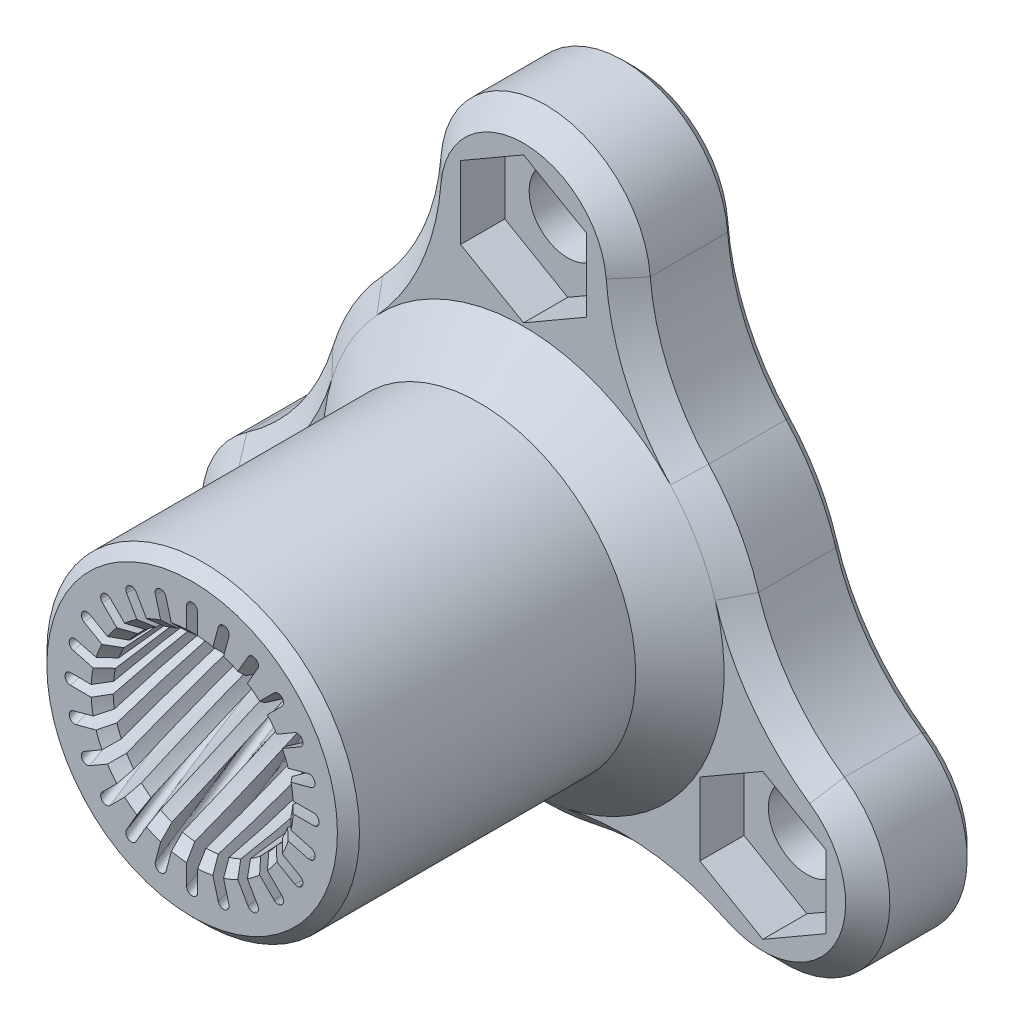
from build123d import *

# Parameters (mm, degrees)
SKETCH1_R              = 7.075
SKETCH1_R_2            = 4.075
BOSS_EXTRUDE1_DEPTH    = 20
CHAMFER3_SIZE          = 0.5
CUT_SWEEP1_PITCH       = 100
CUT_SWEEP1_HEIGHT      = 20
CUT_SWEEP1_RADIUS      = 4
CUT_SWEEP1_START_ANGLE = 180
CIRPATTERN1_COUNT      = 24
SKETCH5_R              = 1.75
SKETCH5_R_2            = 7.075
BOSS_EXTRUDE2_DEPTH    = 3
SKETCH6_R              = 7.075
BOSS_EXTRUDE3_DEPTH    = 2
CHAMFER1_SIZE          = 2
CHAMFER2_SIZE          = 1
CHAMFER4_SIZE          = 0.5


with BuildPart() as part:
    # Sketch1 → Boss-Extrude1 (new body)
    with BuildSketch(Plane.XY):
        Circle(SKETCH1_R)
        Circle(SKETCH1_R_2, mode=Mode.SUBTRACT)
    extrude(amount=BOSS_EXTRUDE1_DEPTH)

    # Chamfer3
    chamfer3_edges = [part.edges().sort_by_distance(p)[0] for p in [
        (-4.075, 0, 0),
        (-4.075, 0, 20),
    ]]
    chamfer(chamfer3_edges, length=CHAMFER3_SIZE)

    # Cut-Sweep1: sweep along a helix
    with BuildLine() as cut_sweep1_path:
        add(Helix(CUT_SWEEP1_PITCH, CUT_SWEEP1_HEIGHT, CUT_SWEEP1_RADIUS, center=(0, 0, 20), direction=(0, 0, -1), mode=Mode.PRIVATE).rotate(Axis((0, 0, 20), (0, 0, -1)), CUT_SWEEP1_START_ANGLE))
    # Sketch4 → Cut-Sweep1 (sweep, cut)
    with BuildSketch(Plane.XY.offset(20)):
        with BuildLine():
            Line((3, 0.25), (5.5, 0.25))
            ThreePointArc((5.5, 0.25), (5.75, 0), (5.5, -0.25))
            Line((5.5, -0.25), (3, -0.25))
            ThreePointArc((3, -0.25), (2.75, 0), (3, 0.25))
        make_face()
    cut_sweep1 = sweep(path=cut_sweep1_path.line, is_frenet=True, mode=Mode.SUBTRACT)

    # CirPattern1: Cut-Sweep1 ×24 about axis
    cirpattern1_axis = Axis((0, 0, 20), (0, 0, -1))
    for i in range(1, CIRPATTERN1_COUNT):
        add(cut_sweep1.rotate(cirpattern1_axis, i * 360 / CIRPATTERN1_COUNT), mode=Mode.SUBTRACT)

    # Sketch5 → Boss-Extrude2 (add)
    with BuildSketch(Plane(origin=(0, 0, 0), x_dir=(-1, 0, 0), z_dir=(0, 0, -1))):
        with BuildLine():
            ThreePointArc((4.735091195, 12.876047034), (0, 17.25), (-4.735091195, 12.876047034))
            ThreePointArc((-4.735091195, 12.876047034), (-5.548815907, 9.644291187), (-7.379318565, 6.859393742))
            ThreePointArc((-7.379318565, 6.859393742), (-8.725205943, 5.0375), (-9.630068518, 2.960980469))
            ThreePointArc((-9.630068518, 2.960980469), (-11.126609123, -0.016730057), (-13.518529429, -2.337314253))
            ThreePointArc((-13.518529429, -2.337314253), (-14.938938215, -8.625), (-8.783438234, -10.538732781))
            ThreePointArc((-8.783438234, -10.538732781), (-5.577793216, -9.62756113), (-2.250749953, -9.820374211))
            ThreePointArc((-2.250749953, -9.820374211), (0, -10.075), (2.250749953, -9.820374211))
            ThreePointArc((2.250749953, -9.820374211), (5.577793216, -9.62756113), (8.783438234, -10.538732781))
            ThreePointArc((8.783438234, -10.538732781), (14.938938215, -8.625), (13.518529429, -2.337314253))
            ThreePointArc((13.518529429, -2.337314253), (11.126609123, -0.016730057), (9.630068518, 2.960980469))
            ThreePointArc((9.630068518, 2.960980469), (8.725205943, 5.0375), (7.379318565, 6.859393742))
            ThreePointArc((7.379318565, 6.859393742), (5.548815907, 9.644291187), (4.735091195, 12.876047034))
        make_face()
        with Locations((0, 12.5)):
            Circle(SKETCH5_R, mode=Mode.SUBTRACT)
        with Locations((10.825317547, -6.25)):
            Circle(SKETCH5_R, mode=Mode.SUBTRACT)
        with Locations((-10.825317547, -6.25)):
            Circle(SKETCH5_R, mode=Mode.SUBTRACT)
        Circle(SKETCH5_R_2, mode=Mode.SUBTRACT)
    extrude(amount=-BOSS_EXTRUDE2_DEPTH)

    # Sketch6 → Boss-Extrude3 (add)
    with BuildSketch(Plane.XY.offset(3)):
        with BuildLine():
            ThreePointArc((-13.518529429, -2.337314253), (-11.126609123, -0.016730057), (-9.630068518, 2.960980469))
            ThreePointArc((-9.630068518, 2.960980469), (-8.725205943, 5.0375), (-7.379318565, 6.859393742))
            ThreePointArc((-7.379318565, 6.859393742), (-5.548815907, 9.644291187), (-4.735091195, 12.876047034))
            ThreePointArc((-4.735091195, 12.876047034), (0, 17.25), (4.735091195, 12.876047034))
            ThreePointArc((4.735091195, 12.876047034), (5.548815907, 9.644291187), (7.379318565, 6.859393742))
            ThreePointArc((7.379318565, 6.859393742), (8.725205943, 5.0375), (9.630068518, 2.960980469))
            ThreePointArc((9.630068518, 2.960980469), (11.126609123, -0.016730057), (13.518529429, -2.337314253))
            ThreePointArc((13.518529429, -2.337314253), (14.938938215, -8.625), (8.783438234, -10.538732781))
            ThreePointArc((8.783438234, -10.538732781), (5.577793216, -9.62756113), (2.250749953, -9.820374211))
            ThreePointArc((2.250749953, -9.820374211), (0, -10.075), (-2.250749953, -9.820374211))
            ThreePointArc((-2.250749953, -9.820374211), (-5.577793216, -9.62756113), (-8.783438234, -10.538732781))
            ThreePointArc((-8.783438234, -10.538732781), (-14.938938215, -8.625), (-13.518529429, -2.337314253))
        make_face()
        Circle(SKETCH6_R, mode=Mode.SUBTRACT)
        Polygon((13.675317547, -7.895448267), (13.675317547, -4.604551733), (10.825317547, -2.959103466), (7.975317547, -4.604551733), (7.975317547, -7.895448267), (10.825317547, -9.540896534), align=None, mode=Mode.SUBTRACT)
        Polygon((0, 15.790896534), (-2.85, 14.145448267), (-2.85, 10.854551733), (0, 9.209103466), (2.85, 10.854551733), (2.85, 14.145448267), align=None, mode=Mode.SUBTRACT)
        Polygon((-13.675317547, -7.895448267), (-10.825317547, -9.540896534), (-7.975317547, -7.895448267), (-7.975317547, -4.604551733), (-10.825317547, -2.959103466), (-13.675317547, -4.604551733), align=None, mode=Mode.SUBTRACT)
    extrude(amount=BOSS_EXTRUDE3_DEPTH)

    # Chamfer1
    chamfer1_edges = [part.edges().sort_by_distance(p)[0] for p in [
        (-7.075, 0, 5),
    ]]
    chamfer(chamfer1_edges, length=CHAMFER1_SIZE)

    # Chamfer2
    chamfer2_edges = [part.edges().sort_by_distance(p)[0] for p in [
        (-14.938938215, -8.625, 5),
        (-5.577793216, -9.62756113, 5),
        (0, -10.075, 5),
        (5.577793216, -9.62756113, 5),
        (14.938938215, -8.625, 5),
        (11.126609123, -0.016730057, 5),
        (8.725205943, 5.0375, 5),
        (5.548815907, 9.644291187, 5),
        (0, 17.25, 5),
        (-5.548815907, 9.644291187, 5),
        (-8.725205943, 5.0375, 5),
        (-11.126609123, -0.016730057, 5),
    ]]
    chamfer(chamfer2_edges, length=CHAMFER2_SIZE - 0.0001)  # a hair under: the kernel refuses the full size

    # Chamfer4
    chamfer4_edges = [part.edges().sort_by_distance(p)[0] for p in [
        (-7.075, 0, 20),
        (-11.126609123, -0.016730057, 0),
        (-8.725205943, 5.0375, 0),
        (-5.548815907, 9.644291187, 0),
        (0, 17.25, 0),
        (5.548815907, 9.644291187, 0),
        (8.725205943, 5.0375, 0),
        (11.126609123, -0.016730057, 0),
        (14.938938215, -8.625, 0),
        (5.577793216, -9.62756113, 0),
        (0, -10.075, 0),
        (-5.577793216, -9.62756113, 0),
        (-14.938938215, -8.625, 0),
        (1.75, 12.5, 0),
        (-9.075317547, -6.25, 0),
        (12.575317547, -6.25, 0),
    ]]
    chamfer(chamfer4_edges, length=CHAMFER4_SIZE)


solid = part.part
